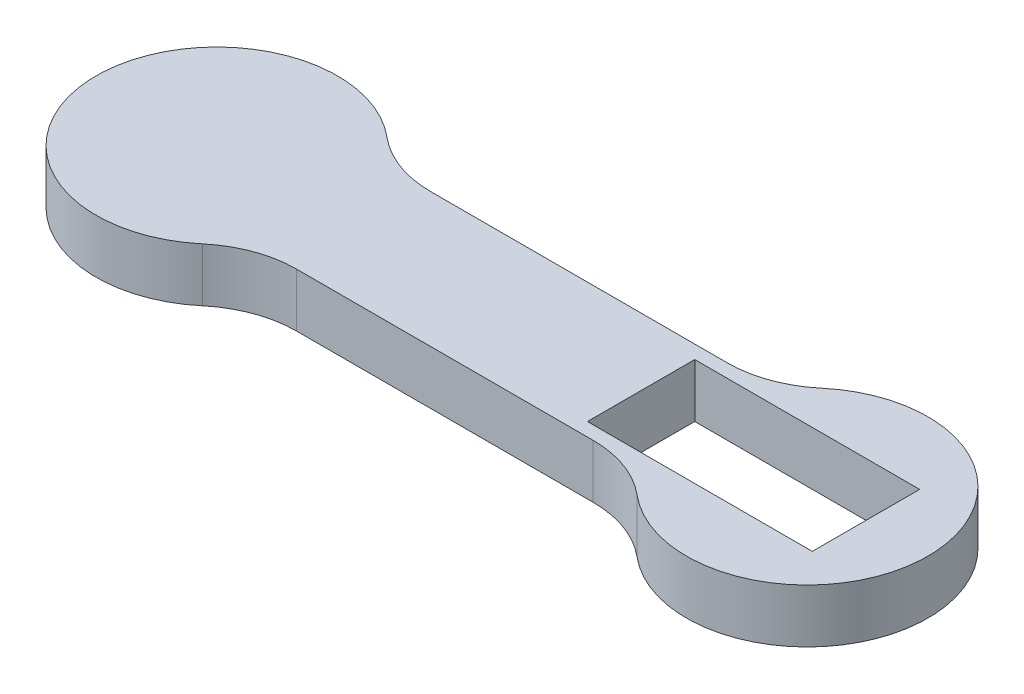
from build123d import *

# Parameters (mm, degrees)
BOSS_EXTRUDE1_DEPTH = 10
SKETCH3_W           = 41.9
SKETCH3_H           = 20
CUT_EXTRUDE1_DEPTH  = 135.768319719


with BuildPart() as part:
    # Sketch2 → Boss-Extrude1 (new body)
    with BuildSketch(Plane(origin=(0, 0, 0), x_dir=(1, 0, 0), z_dir=(0, 1, 0))):
        with BuildLine():
            Line((27.386127875, 12.5), (82.613872125, 12.5))
            ThreePointArc((82.613872125, 12.5), (89.47381553, 13.713271267), (95.501461713, 17.205882353))
            ThreePointArc((95.501461713, 17.205882353), (132.5, 0), (95.501461713, -17.205882353))
            ThreePointArc((95.501461713, -17.205882353), (89.47381553, -13.713271267), (82.613872125, -12.5))
            Line((82.613872125, -12.5), (27.386127875, -12.5))
            ThreePointArc((27.386127875, -12.5), (20.52618447, -13.713271267), (14.498538287, -17.205882353))
            ThreePointArc((14.498538287, -17.205882353), (-22.5, 0), (14.498538287, 17.205882353))
            ThreePointArc((14.498538287, 17.205882353), (20.52618447, 13.713271267), (27.386127875, 12.5))
        make_face()
    extrude(amount=BOSS_EXTRUDE1_DEPTH)

    # Sketch3 → Cut-Extrude1 (cut, through all)
    with BuildSketch(Plane(origin=(0, 10, 0), x_dir=(1, 0, 0), z_dir=(0, 1, 0))):
        with Locations((100, 0)):
            Rectangle(SKETCH3_W, SKETCH3_H)
    extrude(amount=-CUT_EXTRUDE1_DEPTH, mode=Mode.SUBTRACT)


solid = part.part
